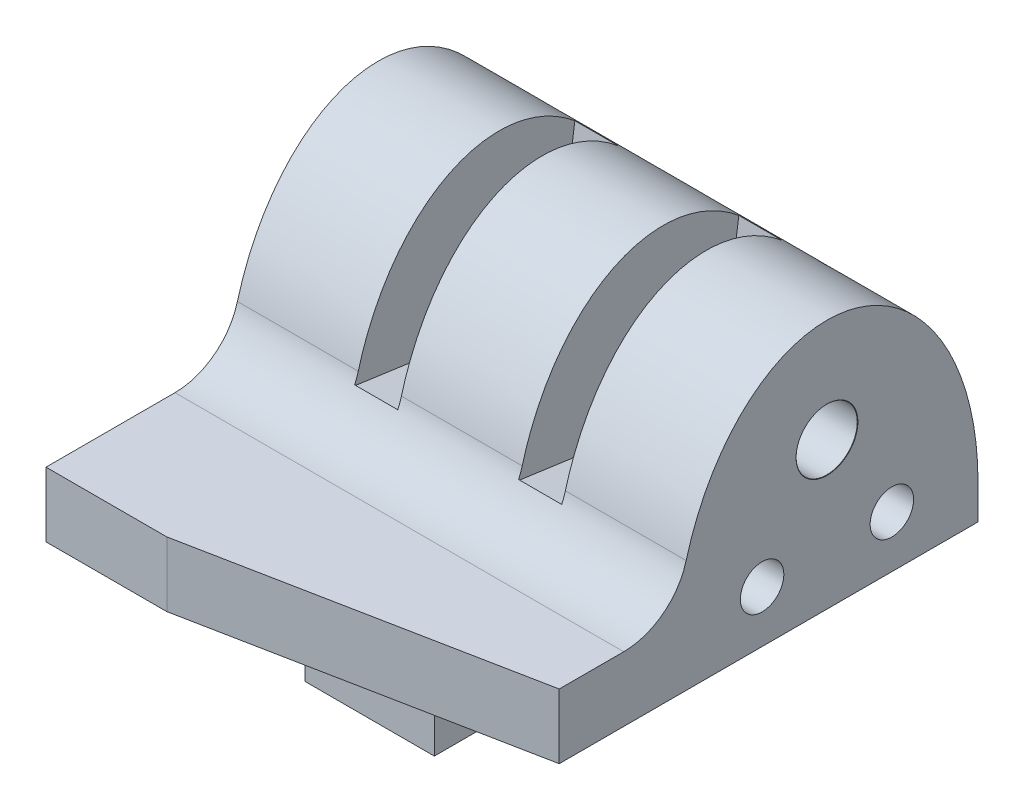
from build123d import *

# Parameters (mm, degrees)
BOSS_EXTRUDE1_DEPTH            = 33.02
M4_CLEARANCE_HOLE1_D           = 4.5
M4_CLEARANCE_HOLE1_CSINK_D     = 4.55
M4_CLEARANCE_HOLE1_CSINK_ANGLE = 100
SKETCH5_W                      = 9.525
SKETCH5_H                      = 25.4
BOSS_EXTRUDE2_DEPTH            = 9.525
F_8_CLEARANCE_HOLE1_D          = 4.4958
CUT_EXTRUDE1_DEPTH             = 51.586230043
CUT_EXTRUDE1_DEPTH_BACK        = 51.586230043
CUT_EXTRUDE3_DEPTH             = 3.175
LPATTERN1_COUNT                = 2
LPATTERN1_PITCH                = 12.065
CUT_EXTRUDE4_DEPTH             = 2.413
SKETCH13_R                     = 1.599999975
CUT_EXTRUDE5_DEPTH             = 9.525


with BuildPart() as part:
    # Sketch1 → Boss-Extrude1 (new body)
    with BuildSketch(Plane.YZ):
        with BuildLine():
            Line((0, 0), (0, 35.56))
            Line((0, 35.56), (4.7625, 35.56))
            Line((4.7625, 35.56), (4.7625, 26.070051643))
            ThreePointArc((4.7625, 26.070051643), (5.742064598, 23.176817123), (8.277799105, 21.473760076))
            add(Edge.make_bspline(
                [(2.54, 0), (15.72103374, 0), (18.14439364, 9.069444242), (20.567753539, 18.138888484), (8.277799105, 21.473760076)],
                knots=[1.570796327, 1.570796327, 1.570796327, 2.95668879, 2.95668879, 4.342581253, 4.342581253, 4.342581253], degree=2, weights=[1, 0.769367284, 1, 0.769367284, 1]))
            Line((2.54, 0), (0, 0))
        make_face()
    extrude(amount=BOSS_EXTRUDE1_DEPTH)

    # M4 Clearance Hole1 (through all)
    with Locations(Plane(origin=(33.02, 0, 0), x_dir=(0, 0, -1), z_dir=(1, 0, 0))):
        with Locations((-11.1125, 10.795)):
            CounterSinkHole(M4_CLEARANCE_HOLE1_D / 2, M4_CLEARANCE_HOLE1_CSINK_D / 2, counter_sink_angle=M4_CLEARANCE_HOLE1_CSINK_ANGLE)

    # Sketch5 → Boss-Extrude2 (add)
    with BuildSketch(Plane(origin=(8.89, 0, 0), x_dir=(0, -1, 0), z_dir=(-1, 0, 0))):
        with Locations((4.7625, 12.7)):
            Rectangle(SKETCH5_W, SKETCH5_H)
    extrude(amount=-BOSS_EXTRUDE2_DEPTH)

    # #8 Clearance Hole1 (through all)
    with Locations(Plane.ZY):
        with Locations((6.35, -4.7625), (19.05, -4.7625)):
            Hole(F_8_CLEARANCE_HOLE1_D / 2)

    # Sketch8 → Cut-Extrude1 (cut, two sides: drawn at the far end of the back side and taken through both)
    with BuildSketch(Plane(origin=(0, 4.7625, 0), x_dir=(-1, 0, 0), z_dir=(0, 1, 0)).offset(-CUT_EXTRUDE1_DEPTH_BACK)):
        Polygon((-33.02, 35.56), (-8.89, 35.56), (-33.02, 30.815025822), align=None)
    extrude(amount=CUT_EXTRUDE1_DEPTH + CUT_EXTRUDE1_DEPTH_BACK, mode=Mode.SUBTRACT)

    # Sketch9 → Cut-Extrude3 (cut)
    with BuildSketch(Plane.YZ.offset(8.89)):
        with BuildLine():
            Line((7.470230181, 21.675508242), (5.416036429, 7.059160216))
            Line((5.416036429, 7.059160216), (16.269581823, 5.533793887))
            ThreePointArc((16.269581823, 5.533793887), (22.282600027, 19.280935147), (7.470230181, 21.675508242))
        make_face()
    cut_extrude3 = extrude(amount=CUT_EXTRUDE3_DEPTH, mode=Mode.SUBTRACT)

    # LPattern1: Cut-Extrude3 ×2
    with Locations(*[(i * LPATTERN1_PITCH, 0, 0) for i in range(1, LPATTERN1_COUNT)]):
        add(cut_extrude3, mode=Mode.SUBTRACT)

    # Sketch12 → Cut-Extrude4 (cut)
    with BuildSketch(Plane(origin=(27.94, 0, 0), x_dir=(0, 0, -1), z_dir=(1, 0, 0))):
        Polygon((-9.0805, 0), (-3.5941, 0), (-3.5941, 5.393787258), (-6.3373, 6.977574517), (-9.0805, 5.393787258), align=None)
        Polygon((-18.6309, 0), (-13.1445, 0), (-13.1445, 5.393787258), (-15.8877, 6.977574517), (-18.6309, 5.393787258), align=None)
    extrude(amount=-CUT_EXTRUDE4_DEPTH, mode=Mode.SUBTRACT)

    # Sketch13 → Cut-Extrude5 (cut)
    with BuildSketch(Plane.YZ.offset(33.02)):
        with Locations((3.81, 15.8877)):
            Circle(SKETCH13_R)
        with Locations((3.81, 6.3373)):
            Circle(SKETCH13_R)
    extrude(amount=-CUT_EXTRUDE5_DEPTH, mode=Mode.SUBTRACT)


solid = part.part
